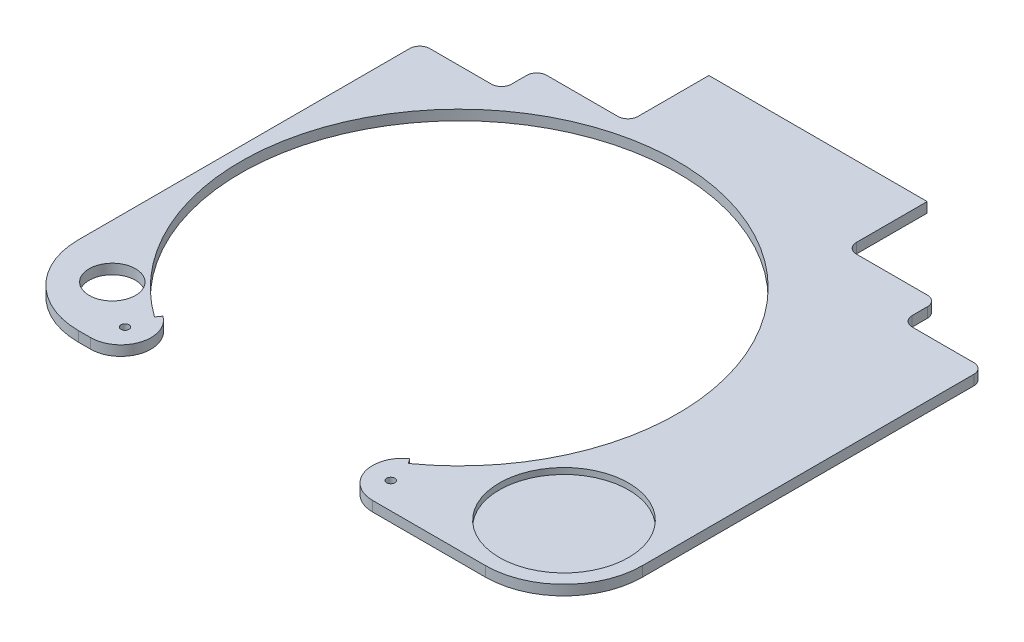
from build123d import *

# Parameters (mm, degrees)
ESQUISSE1_W             = 280.2
ESQUISSE1_H             = 276.282873123
BOSS_EXTRU_1_DEPTH      = 5
ENL_V_MAT_EXTRU_1_DEPTH = 283.344868376
ENL_V_MAT_EXTRU_3_DEPTH = 283.344868376
ESQUISSE5_R             = 2
ENL_V_MAT_EXTRU_4_DEPTH = 283.344868376
ENL_V_MAT_EXTRU_5_DEPTH = 283.344868376
ESQUISSE7_R             = 11.5
ENL_V_MAT_EXTRU_6_DEPTH = 283.344868376
ENL_V_MAT_EXTRU_7_DEPTH = 3


with BuildPart() as part:
    # Esquisse1 → Boss.-Extru.1 (new body)
    with BuildSketch(Plane(origin=(0, 0, 0), x_dir=(1, 0, 0), z_dir=(0, 1, 0))):
        with Locations((0, -106.941436562)):
            Rectangle(ESQUISSE1_W, ESQUISSE1_H)
    extrude(amount=BOSS_EXTRU_1_DEPTH)

    # Esquisse2 → Enlèv. mat.-Extru.1 (cut, through all)
    with BuildSketch(Plane(origin=(0, 5, 0), x_dir=(1, 0, 0), z_dir=(0, 1, 0))):
        with BuildLine():
            Line((-86.286307054, -217.873386842), (-88.029045643, -220.315284098))
            ThreePointArc((-88.029045643, -220.315284098), (-128.330678708, -98.90890093), (-25, -23.5))
            ThreePointArc((-25, -23.5), (78.330678708, -98.90890093), (38.029045643, -220.315284098))
            Line((38.029045643, -220.315284098), (36.286307054, -217.873386842))
            ThreePointArc((36.286307054, -217.873386842), (30.714652713, -234.657679446), (45, -245.082873123))
            Line((45, -245.082873123), (-95, -245.082873123))
            ThreePointArc((-95, -245.082873123), (-80.714652713, -234.657679446), (-86.286307054, -217.873386842))
        make_face()
    extrude(amount=-ENL_V_MAT_EXTRU_1_DEPTH, mode=Mode.SUBTRACT)

    # Esquisse4 → Enlèv. mat.-Extru.3 (cut, through all)
    with BuildSketch(Plane(origin=(0, 5, 0), x_dir=(1, 0, 0), z_dir=(0, 1, 0))):
        with BuildLine():
            Line((140.1, -245.082873123), (101.1, -245.082873123))
            ThreePointArc((101.1, -245.082873123), (128.677164466, -233.660037589), (140.1, -206.082873123))
            Line((140.1, -206.082873123), (140.1, -245.082873123))
        make_face()
        with BuildLine():
            Line((-101.1, -245.082873123), (-140.1, -245.082873123))
            Line((-140.1, -245.082873123), (-140.1, -206.082873123))
            ThreePointArc((-140.1, -206.082873123), (-128.677164466, -233.660037589), (-101.1, -245.082873123))
        make_face()
    extrude(amount=-ENL_V_MAT_EXTRU_3_DEPTH, mode=Mode.SUBTRACT)

    # Esquisse5 → Enlèv. mat.-Extru.4 (cut, through all)
    with BuildSketch(Plane(origin=(0, 5, 0), x_dir=(1, 0, 0), z_dir=(0, 1, 0))):
        with Locations((-91, -232)):
            Circle(ESQUISSE5_R)
        with Locations((41, -232)):
            Circle(ESQUISSE5_R)
    extrude(amount=-ENL_V_MAT_EXTRU_4_DEPTH, mode=Mode.SUBTRACT)

    # Esquisse6 → Enlèv. mat.-Extru.5 (cut, through all)
    with BuildSketch(Plane(origin=(0, 5, 0), x_dir=(1, 0, 0), z_dir=(0, 1, 0))):
        with BuildLine():
            Line((140.1, 31.2), (0, 31.2))
            Line((0, 31.2), (-140.1, 31.2))
            Line((-140.1, 31.2), (-140.1, -41.5125))
            ThreePointArc((-140.1, -41.5125), (-138.635533906, -37.976966094), (-135.1, -36.5125))
            Line((-135.1, -36.5125), (-104.5, -36.5125))
            ThreePointArc((-104.5, -36.5125), (-100.964466094, -35.048033906), (-99.5, -31.5125))
            Line((-99.5, -31.5125), (-99.5, -24))
            ThreePointArc((-99.5, -24), (-98.035533906, -20.464466094), (-94.5, -19))
            Line((-94.5, -19), (-59.209388013, -19))
            ThreePointArc((-59.209388013, -19), (-55.673854107, -17.535533906), (-54.209388013, -14))
            Line((-54.209388013, -14), (-54.209388013, 21.2))
            Line((-54.209388013, 21.2), (54.209388013, 21.2))
            Line((54.209388013, 21.2), (54.209388013, -14))
            ThreePointArc((54.209388013, -14), (55.673854107, -17.535533906), (59.209388013, -19))
            Line((59.209388013, -19), (94.5, -19))
            ThreePointArc((94.5, -19), (98.035533906, -20.464466094), (99.5, -24))
            Line((99.5, -24), (99.5, -31.5125))
            ThreePointArc((99.5, -31.5125), (100.964466094, -35.048033906), (104.5, -36.5125))
            Line((104.5, -36.5125), (135.1, -36.5125))
            ThreePointArc((135.1, -36.5125), (138.635533906, -37.976966094), (140.1, -41.5125))
            Line((140.1, -41.5125), (140.1, 31.2))
        make_face()
    extrude(amount=-ENL_V_MAT_EXTRU_5_DEPTH, mode=Mode.SUBTRACT)

    # Esquisse7 → Enlèv. mat.-Extru.6 (cut, through all)
    with BuildSketch(Plane(origin=(0, 5, 0), x_dir=(1, 0, 0), z_dir=(0, 1, 0))):
        with Locations((-113.5, -215.8)):
            Circle(ESQUISSE7_R)
    extrude(amount=-ENL_V_MAT_EXTRU_6_DEPTH, mode=Mode.SUBTRACT)

    # Esquisse3 → Enlèv. mat.-Extru.7 (cut)
    with BuildSketch(Plane(origin=(0, 5, 0), x_dir=(1, 0, 0), z_dir=(0, 1, 0))):
        with BuildLine():
            ThreePointArc((89.861120923, -236.142437027), (131.159563905, -217.3217522), (112.338879077, -176.023309218))
            ThreePointArc((112.338879077, -176.023309218), (71.040436095, -194.843994045), (89.861120923, -236.142437027))
        make_face()
    extrude(amount=-ENL_V_MAT_EXTRU_7_DEPTH, mode=Mode.SUBTRACT)


solid = part.part
